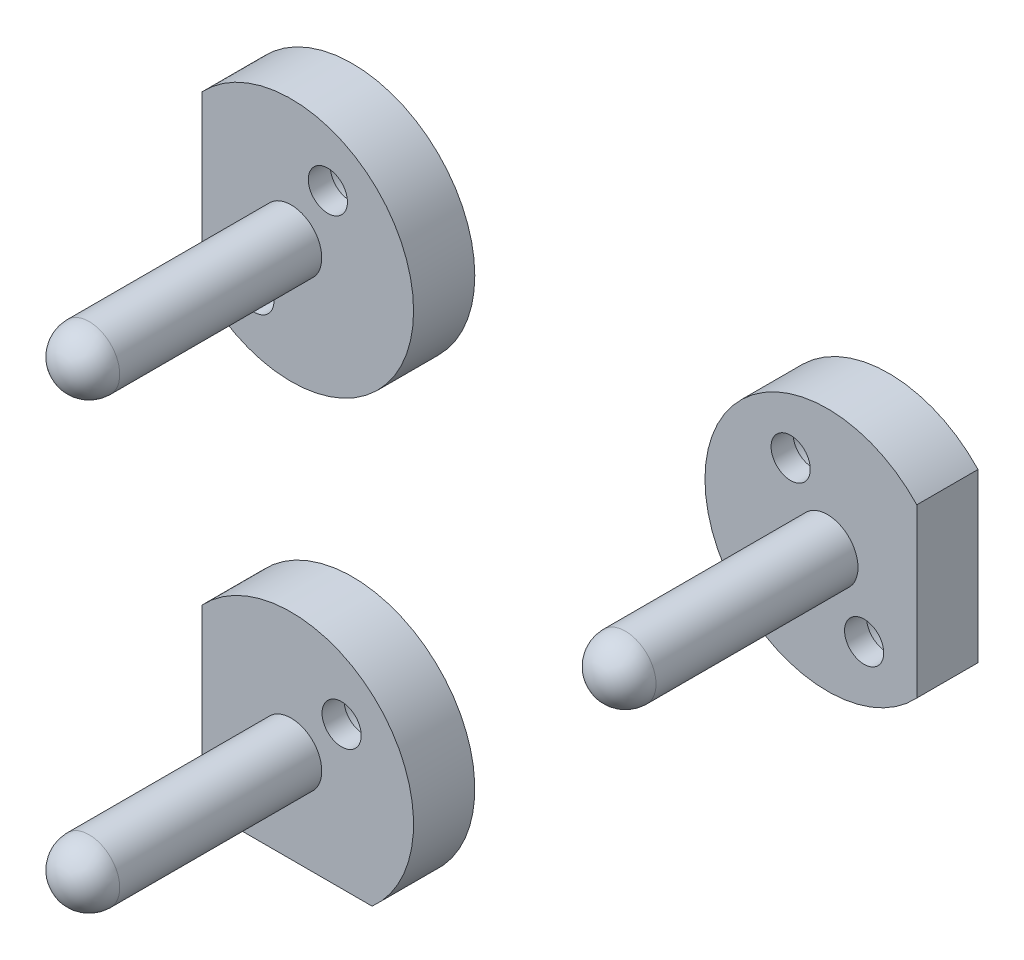
from build123d import *

# Parameters (mm, degrees)
SKETCH_1_R          = 10
EXTRUDE_1_DEPTH     = 5
EXTRUDE_1_2_DEPTH   = 5
EXTRUDE_1_3_DEPTH   = 5
SKETCH_2_R          = 2.5
EXTRUDE_2_DEPTH     = 19
FILLET_4_R          = 2.5
FILLET_5_R          = 2.5
FILLET_6_R          = 2.5
CUT_EXTRUDE_1_DEPTH = 10
SKETCH_5_R          = 2.85
CUT_EXTRUDE_2_DEPTH = 3.2
CUT_EXTRUDE_3_REACH = 46.821
SKETCH_6_R          = 1.6


with BuildPart() as part:
    # 草圖1 → 填料-伸長1 (new body)
    with BuildSketch(Plane.XY):
        with Locations((-21.9, 16.9)):
            Circle(SKETCH_1_R)
    extrude(amount=EXTRUDE_1_DEPTH)



with BuildPart() as body_2:
    # 草圖1 → Extrude 1 2 (new body)
    with BuildSketch(Plane.XY):
        with Locations((-21.9, -19.4)):
            Circle(SKETCH_1_R)
    extrude(amount=EXTRUDE_1_2_DEPTH)


with BuildPart() as body_3:
    # 草圖1 → Extrude 1 3 (new body)
    with BuildSketch(Plane.XY):
        with Locations((21.9, 16.9)):
            Circle(SKETCH_1_R)
    extrude(amount=EXTRUDE_1_3_DEPTH)


with BuildPart() as part_1:
    add(part.part)

    add(body_2.part)  # 填料-伸長2 merges body 2

    add(body_3.part)  # 填料-伸長2 merges body 3
    # 草圖2 → 填料-伸長2 (add)
    with BuildSketch(Plane.XY.offset(5)):
        with Locations((-21.9, 16.9)):
            Circle(SKETCH_2_R)
        with Locations((21.9, 16.9)):
            Circle(SKETCH_2_R)
        with Locations((-21.9, -19.4)):
            Circle(SKETCH_2_R)
    extrude(amount=EXTRUDE_2_DEPTH)

    # 圓角4
    fillet_4_edges = [part_1.edges().sort_by_distance(p)[0] for p in [
        (-24.4, 16.9, 24),
    ]]
    fillet(fillet_4_edges, radius=FILLET_4_R)

    # 圓角5
    fillet_5_edges = [part_1.edges().sort_by_distance(p)[0] for p in [
        (-24.4, -19.4, 24),
    ]]
    fillet(fillet_5_edges, radius=FILLET_5_R)

    # 圓角6
    fillet_6_edges = [part_1.edges().sort_by_distance(p)[0] for p in [
        (19.4, 16.9, 24),
    ]]
    fillet(fillet_6_edges, radius=FILLET_6_R)

    # 草圖4 → 除料-伸長1 (cut)
    with BuildSketch(Plane(origin=(0, 0, 0), x_dir=(-1, 0, 0), z_dir=(0, 0, -1))):
        with BuildLine():
            Line((28.514378278, -26.9), (15.285621722, -26.9))
            ThreePointArc((15.285621722, -26.9), (21.9, -29.4), (28.514378278, -26.9))
        make_face()
        with BuildLine():
            ThreePointArc((29.2, -26.23447145), (31.9, -19.4), (29.2, -12.56552855))
            Line((29.2, -12.56552855), (29.2, -26.23447145))
        make_face()
        with BuildLine():
            ThreePointArc((29.2, 10.06552855), (31.9, 16.9), (29.2, 23.73447145))
            Line((29.2, 23.73447145), (29.2, 10.06552855))
        make_face()
        with BuildLine():
            Line((-29.2, 10.06552855), (-29.2, 23.73447145))
            ThreePointArc((-29.2, 23.73447145), (-31.9, 16.9), (-29.2, 10.06552855))
        make_face()
    extrude(amount=-CUT_EXTRUDE_1_DEPTH, mode=Mode.SUBTRACT)

    # 草圖5 → 除料-伸長2 (cut)
    with BuildSketch(Plane(origin=(0, 0, 0), x_dir=(-1, 0, 0), z_dir=(0, 0, -1))):
        with Locations((-18.9, 21.9)):
            Circle(SKETCH_5_R)
        with Locations((26.023105626, -23.523105626)):
            Circle(SKETCH_5_R)
        with Locations((-24.9, 11.9)):
            Circle(SKETCH_5_R)
        with Locations((24.9, 11.9)):
            Circle(SKETCH_5_R)
        with Locations((18.9, 21.9)):
            Circle(SKETCH_5_R)
        with Locations((17.776894374, -15.276894374)):
            Circle(SKETCH_5_R)
    extrude(amount=-CUT_EXTRUDE_2_DEPTH, mode=Mode.SUBTRACT)

    # 草圖6 → 除料-伸長3 (cut, up to next)
    with BuildSketch(Plane(origin=(0, 0, 3.2), x_dir=(-1, 0, 0), z_dir=(0, 0, -1)), mode=Mode.PRIVATE) as cut_extrude_3_sk1:
        with Locations((-18.9, 21.9)):
            Circle(SKETCH_6_R)
    cut_extrude_3_tool1 = extrude(cut_extrude_3_sk1.sketch, amount=-CUT_EXTRUDE_3_REACH, mode=Mode.PRIVATE) & part_1.part
    # 草圖6 → 除料-伸長3 (cut, up to next)
    with BuildSketch(Plane(origin=(0, 0, 3.2), x_dir=(-1, 0, 0), z_dir=(0, 0, -1)), mode=Mode.PRIVATE) as cut_extrude_3_sk2:
        with Locations((-24.9, 11.9)):
            Circle(SKETCH_6_R)
    cut_extrude_3_tool2 = extrude(cut_extrude_3_sk2.sketch, amount=-CUT_EXTRUDE_3_REACH, mode=Mode.PRIVATE) & part_1.part
    # 草圖6 → 除料-伸長3 (cut, up to next)
    with BuildSketch(Plane(origin=(0, 0, 3.2), x_dir=(-1, 0, 0), z_dir=(0, 0, -1)), mode=Mode.PRIVATE) as cut_extrude_3_sk3:
        with Locations((18.9, 21.9)):
            Circle(SKETCH_6_R)
    cut_extrude_3_tool3 = extrude(cut_extrude_3_sk3.sketch, amount=-CUT_EXTRUDE_3_REACH, mode=Mode.PRIVATE) & part_1.part
    # 草圖6 → 除料-伸長3 (cut, up to next)
    with BuildSketch(Plane(origin=(0, 0, 3.2), x_dir=(-1, 0, 0), z_dir=(0, 0, -1)), mode=Mode.PRIVATE) as cut_extrude_3_sk4:
        with Locations((24.9, 11.9)):
            Circle(SKETCH_6_R)
    cut_extrude_3_tool4 = extrude(cut_extrude_3_sk4.sketch, amount=-CUT_EXTRUDE_3_REACH, mode=Mode.PRIVATE) & part_1.part
    # 草圖6 → 除料-伸長3 (cut, up to next)
    with BuildSketch(Plane(origin=(0, 0, 3.2), x_dir=(-1, 0, 0), z_dir=(0, 0, -1)), mode=Mode.PRIVATE) as cut_extrude_3_sk5:
        with Locations((17.776894374, -15.276894374)):
            Circle(SKETCH_6_R)
    cut_extrude_3_tool5 = extrude(cut_extrude_3_sk5.sketch, amount=-CUT_EXTRUDE_3_REACH, mode=Mode.PRIVATE) & part_1.part
    # 草圖6 → 除料-伸長3 (cut, up to next)
    with BuildSketch(Plane(origin=(0, 0, 3.2), x_dir=(-1, 0, 0), z_dir=(0, 0, -1)), mode=Mode.PRIVATE) as cut_extrude_3_sk6:
        with Locations((26.023105626, -23.523105626)):
            Circle(SKETCH_6_R)
    cut_extrude_3_tool6 = extrude(cut_extrude_3_sk6.sketch, amount=-CUT_EXTRUDE_3_REACH, mode=Mode.PRIVATE) & part_1.part
    add(cut_extrude_3_tool1.solids().sort_by_distance((18.9, 21.9, 3.2))[0], mode=Mode.SUBTRACT)
    add(cut_extrude_3_tool2.solids().sort_by_distance((24.9, 11.9, 3.2))[0], mode=Mode.SUBTRACT)
    add(cut_extrude_3_tool3.solids().sort_by_distance((-18.9, 21.9, 3.2))[0], mode=Mode.SUBTRACT)
    add(cut_extrude_3_tool4.solids().sort_by_distance((-24.9, 11.9, 3.2))[0], mode=Mode.SUBTRACT)
    add(cut_extrude_3_tool5.solids().sort_by_distance((-17.776894, -15.276894, 3.2))[0], mode=Mode.SUBTRACT)
    add(cut_extrude_3_tool6.solids().sort_by_distance((-26.023106, -23.523106, 3.2))[0], mode=Mode.SUBTRACT)


solid = part_1.part
